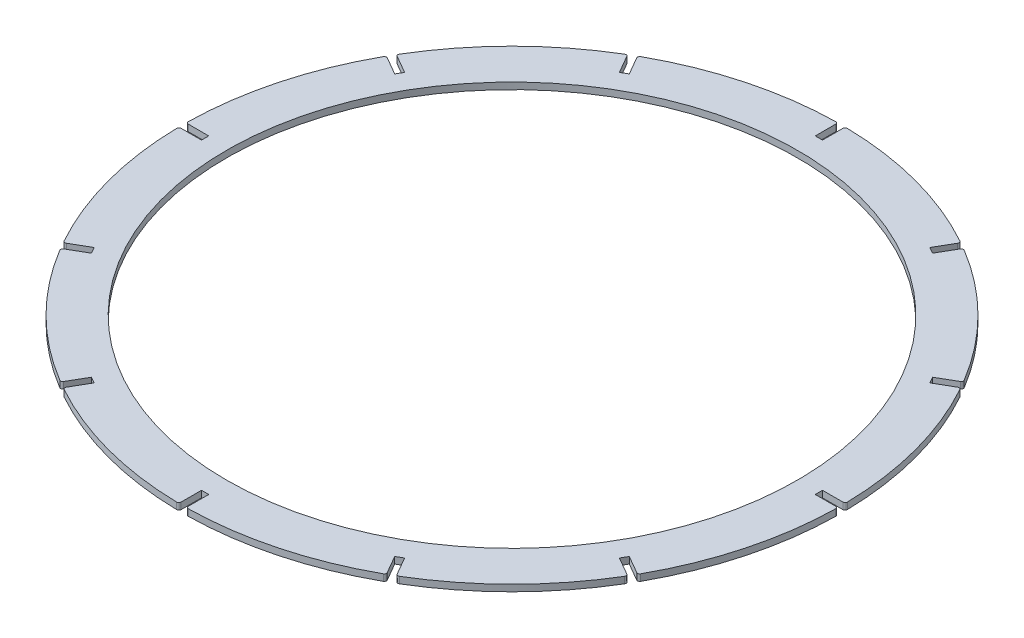
from build123d import *

# Parameters (mm, degrees)
SKETCH1_R                = 150
SKETCH1_R_2              = 130
BOSS_EXTRUDE1_DEPTH      = 3
SKETCH2_W                = 3.3
SKETCH2_H                = 12.624935537
CUT_EXTRUDE1_DEPTH       = 3
FILLET1_R                = 1
CIRPATTERN1_COUNT        = 12
FILLET1_OF_CIRPATTERN1_R = 1


with BuildPart() as part:
    # Sketch1 → Boss-Extrude1 (new body)
    with BuildSketch(Plane(origin=(0, 0, 0), x_dir=(1, 0, 0), z_dir=(0, 1, 0))):
        Circle(SKETCH1_R)
        Circle(SKETCH1_R_2, mode=Mode.SUBTRACT)
    extrude(amount=BOSS_EXTRUDE1_DEPTH)

    # Sketch2 → Cut-Extrude1 (cut)
    with BuildSketch(Plane(origin=(0, 3, 0), x_dir=(1, 0, 0), z_dir=(0, 1, 0))):
        with Locations((0, 146.012467769)):
            Rectangle(SKETCH2_W, SKETCH2_H)
    cut_extrude1 = extrude(amount=-CUT_EXTRUDE1_DEPTH, mode=Mode.SUBTRACT)

    # Fillet1
    fillet1_edges = [part.edges().sort_by_distance(p)[0] for p in [
        (1.65, 1.5, -149.990924725),
        (-1.65, 1.5, -149.990924725),
    ]]
    fillet(fillet1_edges, radius=FILLET1_R)

    # CirPattern1: Cut-Extrude1 ×12 about axis
    cirpattern1_axis = Axis((0, 3, 0), (0, -1, 0))
    for i in range(1, CIRPATTERN1_COUNT):
        add(cut_extrude1.rotate(cirpattern1_axis, i * 360 / CIRPATTERN1_COUNT), mode=Mode.SUBTRACT)

    # Fillet1 of CirPattern1
    fillet1_of_cirpattern1_edges = [part.edges().sort_by_distance(p)[0] for p in [
        (76.424404279, 1.5, -129.070951149),
        (73.566520446, 1.5, -130.720951149),
        (130.720951149, 1.5, -73.566520446),
        (129.070951149, 1.5, -76.424404279),
        (149.990924725, 1.5, 1.65),
        (149.990924725, 1.5, -1.65),
        (129.070951149, 1.5, 76.424404279),
        (130.720951149, 1.5, 73.566520446),
        (73.566520446, 1.5, 130.720951149),
        (76.424404279, 1.5, 129.070951149),
        (-1.65, 1.5, 149.990924725),
        (1.65, 1.5, 149.990924725),
        (-76.424404279, 1.5, 129.070951149),
        (-73.566520446, 1.5, 130.720951149),
        (-130.720951149, 1.5, 73.566520446),
        (-129.070951149, 1.5, 76.424404279),
        (-149.990924725, 1.5, -1.65),
        (-149.990924725, 1.5, 1.65),
        (-129.070951149, 1.5, -76.424404279),
        (-130.720951149, 1.5, -73.566520446),
        (-73.566520446, 1.5, -130.720951149),
        (-76.424404279, 1.5, -129.070951149),
    ]]
    fillet(fillet1_of_cirpattern1_edges, radius=FILLET1_OF_CIRPATTERN1_R)


solid = part.part
